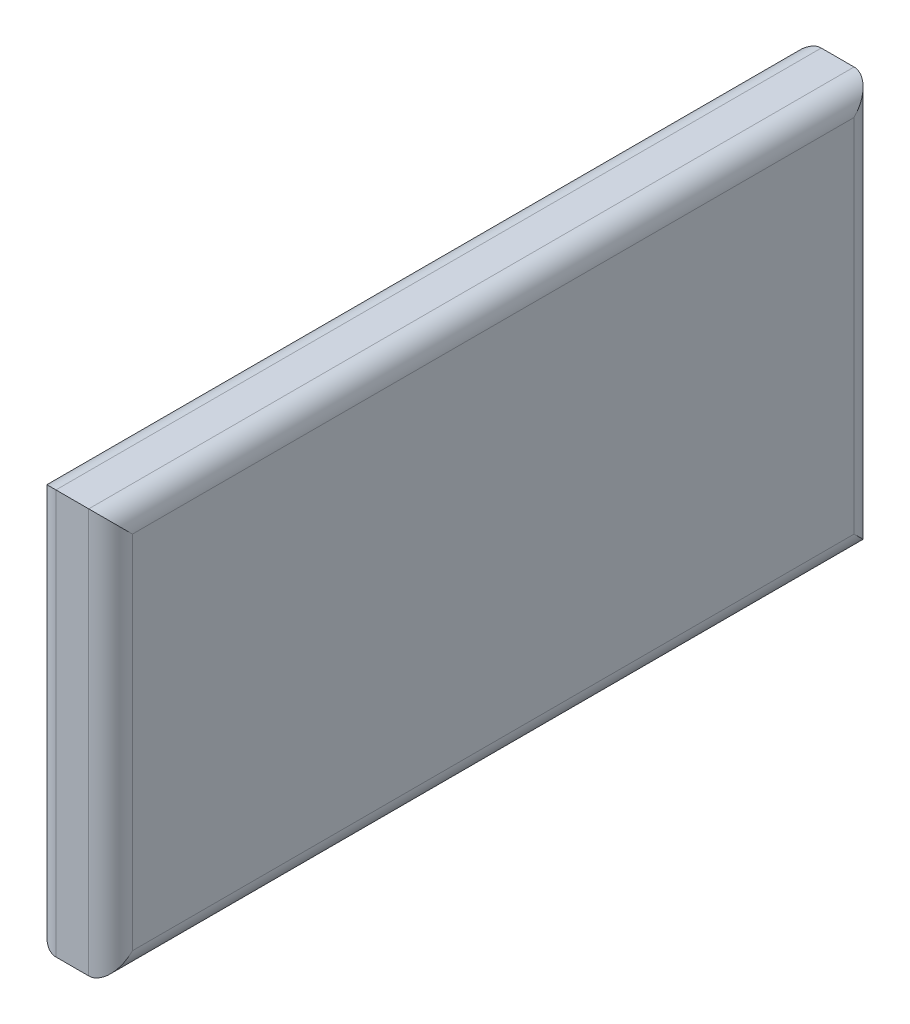
from build123d import *

# Parameters (mm, degrees)
SKETCH1_W           = 70
SKETCH1_H           = 37
BOSS_EXTRUDE1_DEPTH = 7
FILLET1_R           = 2


with BuildPart() as part:
    # Sketch1 → Boss-Extrude1 (new body)
    with BuildSketch(Plane(origin=(0, 0, 0), x_dir=(0, 0, -1), z_dir=(1, 0, 0))):
        with Locations((35, 18.5)):
            Rectangle(SKETCH1_W, SKETCH1_H)
    extrude(amount=BOSS_EXTRUDE1_DEPTH)

    # Fillet1
    fillet1_edges = [part.edges().sort_by_distance(p)[0] for p in [
        (0, 18.5, 0),
        (7, 18.5, 0),
        (7, 18.5, -70),
        (0, 18.5, -70),
        (7, 0, -35),
        (7, 37, -35),
        (0, 37, -35),
        (0, 0, -35),
    ]]
    fillet(fillet1_edges, radius=FILLET1_R)


solid = part.part
